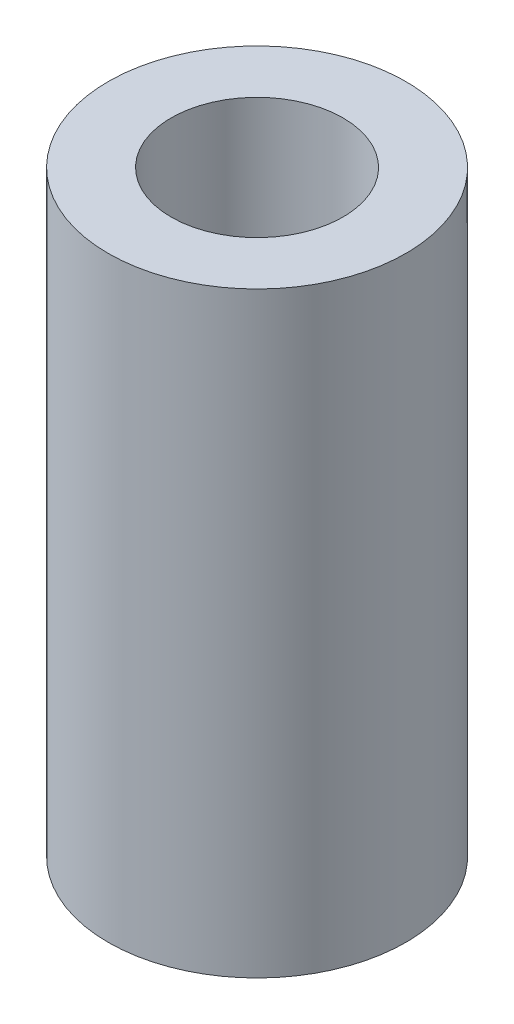
from build123d import *

# Parameters (mm, degrees)
SKETCH1_R           = 7.5
BOSS_EXTRUDE1_DEPTH = 30.065253178
SKETCH2_R           = 4.330551385
CUT_EXTRUDE1_DEPTH  = 32.88133386


with BuildPart() as part:
    # Sketch1 → Boss-Extrude1 (new body)
    with BuildSketch(Plane(origin=(0, 0, 0), x_dir=(1, 0, 0), z_dir=(0, 1, 0))):
        Circle(SKETCH1_R)
    extrude(amount=BOSS_EXTRUDE1_DEPTH)

    # Sketch2 → Cut-Extrude1 (cut, through all)
    with BuildSketch(Plane(origin=(0, 0, 0), x_dir=(1, 0, 0), z_dir=(0, 1, 0))):
        Circle(SKETCH2_R)
    extrude(amount=CUT_EXTRUDE1_DEPTH, mode=Mode.SUBTRACT)


solid = part.part
